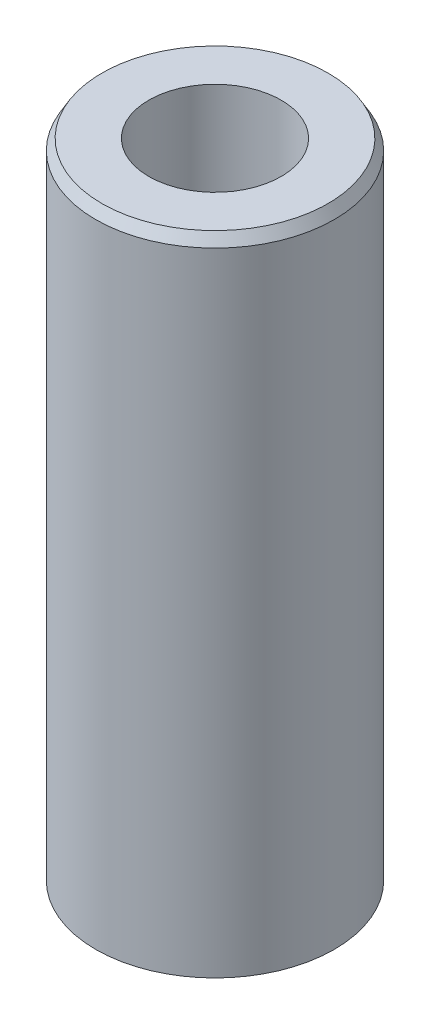
from build123d import *
from OCP.BRepFilletAPI import BRepFilletAPI_MakeChamfer

# Parameters (mm, degrees)
SKETCH1_R           = 27.5
BOSS_EXTRUDE1_DEPTH = 149.621601819
SKETCH2_R           = 15.259765178
CUT_EXTRUDE1_DEPTH  = 155.593414255
CHAMFER1_SIZE       = 2.480804668
CHAMFER1_SIZE2      = 1.432293243


with BuildPart() as part:
    # Sketch1 → Boss-Extrude1 (new body)
    with BuildSketch(Plane(origin=(0, 0, 0), x_dir=(1, 0, 0), z_dir=(0, 1, 0))):
        Circle(SKETCH1_R)
    extrude(amount=BOSS_EXTRUDE1_DEPTH)

    # Sketch2 → Cut-Extrude1 (cut, through all)
    with BuildSketch(Plane(origin=(0, 0, 0), x_dir=(1, 0, 0), z_dir=(0, 1, 0))):
        Circle(SKETCH2_R)
    extrude(amount=CUT_EXTRUDE1_DEPTH, mode=Mode.SUBTRACT)

    # Chamfer1: one chamfer whose edges measure the first distance from different faces: ONE call of the kernel's chamfer builder (chamfer() names one face for all edges)
    chamfer1_edges_1 = [part.edges().sort_by_distance(p)[0] for p in [
        (-27.5, 149.621601819, 0),
    ]]
    chamfer1_side_1 = [part.faces().sort_by_distance(p)[0] for p in [
        (-27.5, 74.81080091, 0),
    ]]
    chamfer1_edges_2 = [part.edges().sort_by_distance(p)[0] for p in [
        (-27.5, 0, 0),
    ]]
    chamfer1_side_2 = [part.faces().sort_by_distance(p)[0] for p in [
        (-26.722182541, 0, 0),
    ]]
    chamfer1 = BRepFilletAPI_MakeChamfer(part.part.solid().wrapped)
    for e in chamfer1_edges_1:
        chamfer1.Add(CHAMFER1_SIZE, CHAMFER1_SIZE2, e.wrapped, chamfer1_side_1[0].wrapped)  # the first distance lies on this face
    for e in chamfer1_edges_2:
        chamfer1.Add(CHAMFER1_SIZE, CHAMFER1_SIZE2, e.wrapped, chamfer1_side_2[0].wrapped)  # the first distance lies on this face
    add(Compound.cast(chamfer1.Shape()), mode=Mode.REPLACE)


solid = part.part
